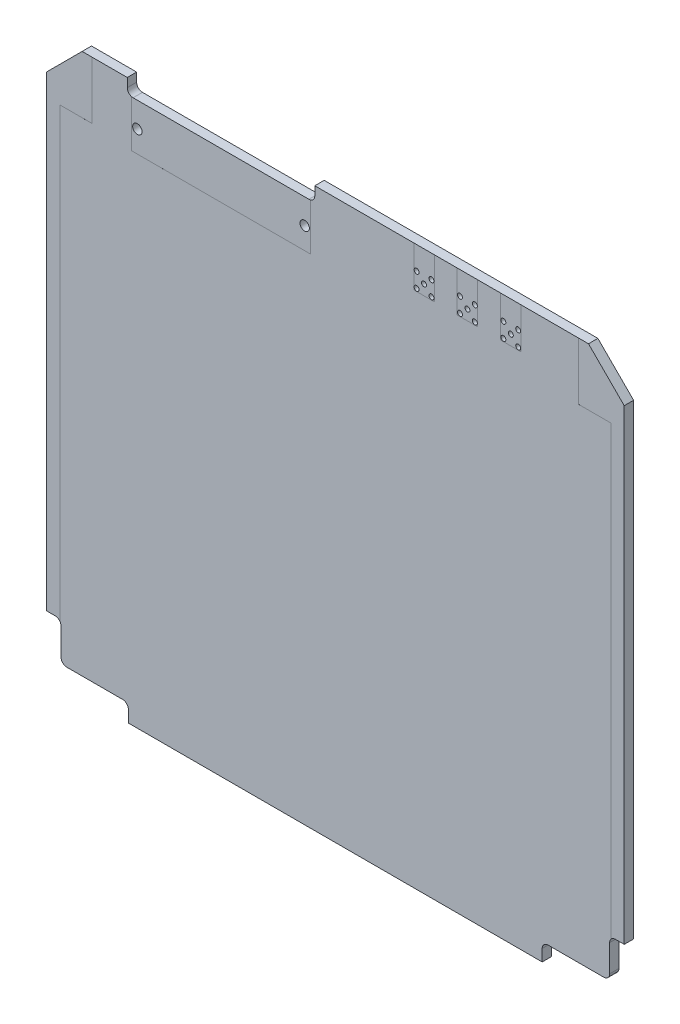
from build123d import *

# Parameters (mm, degrees)
SKETCH1_R           = 0.425
SKETCH1_R_2         = 0.8
BOSS_EXTRUDE1_DEPTH = 1.6
CUT_EXTRUDE1_DEPTH  = 0.0001
CUT_EXTRUDE2_DEPTH  = 0.0001
PARTFOOTPRINTS_W    = 30.48
PARTFOOTPRINTS_H    = 7.989227112
PARTFOOTPRINTS_W_2  = 3.5
PARTFOOTPRINTS_H_2  = 6.95
CUT_EXTRUDE3_DEPTH  = 0.0001


with BuildPart() as part:
    # Sketch1 → Boss-Extrude1 (new body)
    with BuildSketch(Plane(origin=(0, 0, -0.0125), x_dir=(-1, 0, 0), z_dir=(0, 0, -1))):
        with BuildLine():
            Line((35.3, -50), (35.3, -48))
            ThreePointArc((35.3, -48), (35.592893219, -47.292893219), (36.3, -47))
            Line((36.3, -47), (45.8, -47))
            ThreePointArc((45.8, -47), (46.507106781, -46.707106781), (46.8, -46))
            Line((46.8, -46), (46.8, -41.4))
            ThreePointArc((46.8, -41.4), (47.092893219, -40.692893219), (47.8, -40.4))
            Line((47.8, -40.4), (49.3, -40.4))
            Line((49.3, -40.4), (49.3, 39.2))
            Line((49.3, 39.2), (43.2, 45.3))
            Line((43.2, 45.3), (35.500000002, 45.3))
            Line((35.500000002, 45.3), (35.500000002, 43.8))
            ThreePointArc((35.500000002, 43.8), (35.207106783, 43.092893219), (34.500000002, 42.8))
            Line((34.500000002, 42.8), (4.499999998, 42.8))
            ThreePointArc((4.499999998, 42.8), (3.792893217, 43.092893219), (3.499999998, 43.8))
            Line((3.499999998, 43.8), (3.499999998, 45.3))
            Line((3.499999998, 45.3), (-43.2, 45.3))
            Line((-43.2, 45.3), (-49.3, 39.2))
            Line((-49.3, 39.2), (-49.3, -40.4))
            Line((-49.3, -40.4), (-47.8, -40.4))
            ThreePointArc((-47.8, -40.4), (-47.092893219, -40.692893219), (-46.8, -41.4))
            Line((-46.8, -41.4), (-46.8, -46))
            ThreePointArc((-46.8, -46), (-46.507106781, -46.707106781), (-45.8, -47))
            Line((-45.8, -47), (-36.3, -47))
            ThreePointArc((-36.3, -47), (-35.592893219, -47.292893219), (-35.3, -48))
            Line((-35.3, -48), (-35.3, -50))
            Line((-35.3, -50), (35.3, -50))
        make_face()
        with Locations((-21.27, 41.37)):
            Circle(SKETCH1_R, mode=Mode.SUBTRACT)
        with Locations((-23.81, 41.37)):
            Circle(SKETCH1_R, mode=Mode.SUBTRACT)
        with Locations((-22.54, 40.1)):
            Circle(SKETCH1_R, mode=Mode.SUBTRACT)
        with Locations((-13.87, 41.37)):
            Circle(SKETCH1_R, mode=Mode.SUBTRACT)
        with Locations((-23.81, 38.83)):
            Circle(SKETCH1_R, mode=Mode.SUBTRACT)
        with Locations((-16.41, 41.37)):
            Circle(SKETCH1_R, mode=Mode.SUBTRACT)
        with Locations((-15.14, 40.1)):
            Circle(SKETCH1_R, mode=Mode.SUBTRACT)
        with Locations((-21.27, 38.83)):
            Circle(SKETCH1_R, mode=Mode.SUBTRACT)
        with Locations((-28.67, 41.37)):
            Circle(SKETCH1_R, mode=Mode.SUBTRACT)
        with Locations((-31.21, 41.37)):
            Circle(SKETCH1_R, mode=Mode.SUBTRACT)
        with Locations((-16.41, 38.83)):
            Circle(SKETCH1_R, mode=Mode.SUBTRACT)
        with Locations((-29.94, 40.1)):
            Circle(SKETCH1_R, mode=Mode.SUBTRACT)
        with Locations((-31.21, 38.83)):
            Circle(SKETCH1_R, mode=Mode.SUBTRACT)
        with Locations((-28.67, 38.83)):
            Circle(SKETCH1_R, mode=Mode.SUBTRACT)
        with Locations((33.775, 38.54)):
            Circle(SKETCH1_R_2, mode=Mode.SUBTRACT)
        with Locations((5.225, 38.54)):
            Circle(SKETCH1_R_2, mode=Mode.SUBTRACT)
        with Locations((-13.87, 38.83)):
            Circle(SKETCH1_R, mode=Mode.SUBTRACT)
    extrude(amount=-BOSS_EXTRUDE1_DEPTH)

    # thermalContacts_lower → Cut-Extrude1 (cut)
    with BuildSketch(Plane(origin=(0, 0, -0.0125), x_dir=(-1, 0, 0), z_dir=(0, 0, -1))):
        Polygon((47, 35.5), (47, -41.5), (59.827263463, -41.5), (59.827263463, 47), (41.5, 47), (41.5, 41.5), (41.5, 35.5), align=None)
        Polygon((-47, 35.5), (-47, -41.172629575), (-54.178242861, -41.172629575), (-54.178242861, 47.858281552), (-41.5, 47.858281552), (-41.5, 42.552215379), (-41.5, 35.5), align=None)
    extrude(amount=-CUT_EXTRUDE1_DEPTH, mode=Mode.SUBTRACT)

    # thermalContacts_upper → Cut-Extrude2 (cut)
    with BuildSketch(Plane.XY.offset(1.5875)):
        Polygon((-47, 35.5), (-47, -41.5), (-56.192158269, -41.5), (-56.192158269, 47), (-41.5, 47), (-41.5, 41.5), (-41.5, 35.5), align=None)
        Polygon((47, 35.5), (47, -41.5), (59.827263463, -41.5), (59.827263463, 47), (41.5, 47), (41.5, 41.5), (41.5, 35.5), align=None)
    extrude(amount=-CUT_EXTRUDE2_DEPTH, mode=Mode.SUBTRACT)

    # partFootprints → Cut-Extrude3 (cut)
    with BuildSketch(Plane.XY.offset(1.5875)):
        with Locations((-19.5, 38.834613556)):
            Rectangle(PARTFOOTPRINTS_W, PARTFOOTPRINTS_H)
        with Locations((15.14, 41.825)):
            Rectangle(PARTFOOTPRINTS_W_2, PARTFOOTPRINTS_H_2)
        with Locations((22.54, 41.825)):
            Rectangle(PARTFOOTPRINTS_W_2, PARTFOOTPRINTS_H_2)
        with Locations((29.94, 41.825)):
            Rectangle(PARTFOOTPRINTS_W_2, PARTFOOTPRINTS_H_2)
    extrude(amount=-CUT_EXTRUDE3_DEPTH, mode=Mode.SUBTRACT)


solid = part.part
